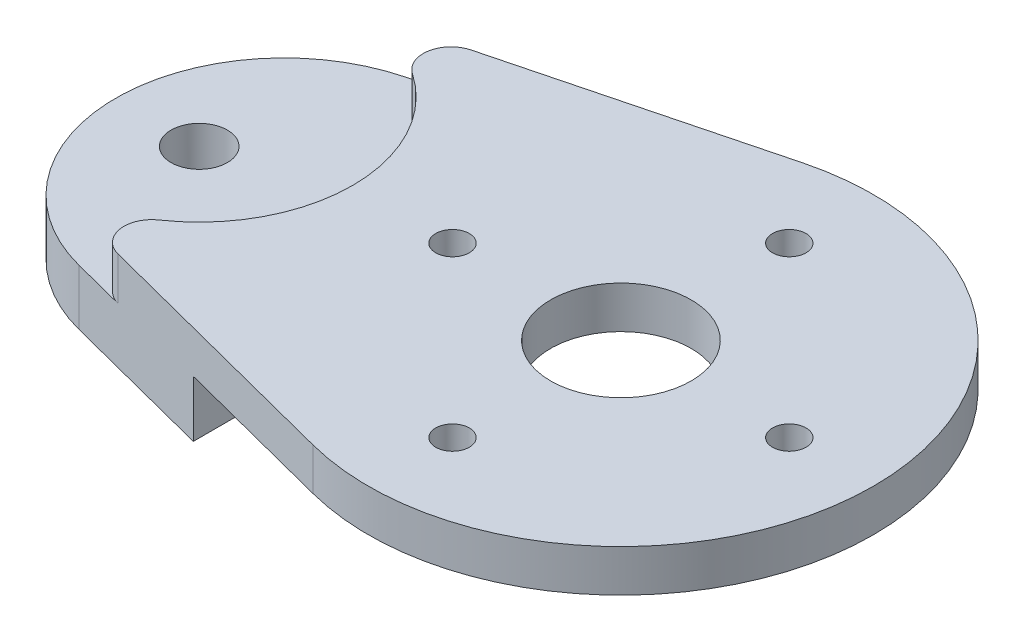
from build123d import *

# Parameters (mm, degrees)
BOSS_EXTRUDE1_DEPTH     = 35.052
CUT_EXTRUDE1_DEPTH      = 231.935593134
CUT_EXTRUDE1_DEPTH_BACK = 231.935593134
SKETCH2_R               = 25.019
SKETCH2_R_2             = 10.033
CUT_EXTRUDE2_START      = -15.24
CUT_EXTRUDE2_DEPTH      = 15.24
FILLET1_R               = 9.906
SKETCH5_R               = 5.969
CUT_EXTRUDE3_DEPTH      = 231.935593134
CIRPATTERN1_COUNT       = 4
SKETCH6_W               = 250.475884559
SKETCH6_H               = 232.654927102
CUT_EXTRUDE4_DEPTH      = 20.066


with BuildPart() as part:
    # Sketch1 → Boss-Extrude1 (new body)
    with BuildSketch(Plane(origin=(0, 0, 0), x_dir=(1, 0, 0), z_dir=(0, 1, 0))):
        with BuildLine():
            Line((-14.986, 58.040528426), (97.409, 87.060792639))
            ThreePointArc((97.409, 87.060792639), (209.804, 0), (97.409, -87.060792639))
            Line((97.409, -87.060792639), (-14.986, -58.040528426))
            ThreePointArc((-14.986, -58.040528426), (-59.944, 0), (-14.986, 58.040528426))
        make_face()
    extrude(amount=BOSS_EXTRUDE1_DEPTH)

    # Sketch2 → Cut-Extrude1 (cut, two sides: drawn at the far end of the back side and taken through both)
    with BuildSketch(Plane(origin=(0, 35.052, 0), x_dir=(1, 0, 0), z_dir=(0, 1, 0)).offset(-CUT_EXTRUDE1_DEPTH_BACK)):
        with Locations(Location((119.888, 0, 0), (0, 0, 270))):
            Circle(SKETCH2_R)
        with Locations(Location((-30.226, 0, 0), (0, 0, 270))):
            Circle(SKETCH2_R_2)
    extrude(amount=CUT_EXTRUDE1_DEPTH + CUT_EXTRUDE1_DEPTH_BACK, mode=Mode.SUBTRACT)

    # Sketch3 → Cut-Extrude2 (cut)
    with BuildSketch(Plane(origin=(0, 35.052, 0), x_dir=(1, 0, 0), z_dir=(0, 1, 0)).offset(CUT_EXTRUDE2_START)):
        with BuildLine():
            ThreePointArc((-25.220705882, 54.380135443), (-59.944, 0), (-25.220705882, -54.380135443))
            ThreePointArc((-25.220705882, -54.380135443), (24.384, 0), (-25.220705882, 54.380135443))
        make_face()
    extrude(amount=CUT_EXTRUDE2_DEPTH, mode=Mode.SUBTRACT)

    # Fillet1
    # the kernel refuses this fillet: 9.906 mm, written as the material it takes off along each edge
    with BuildSketch(Plane(origin=(-25.220705882, 19.812, -54.380135443), x_dir=(0.9595509242122834, 0, -0.28153512008868975), z_dir=(0, 1, 0))) as fillet1_piece_1:
        with BuildLine():
            CenterArc((29.806229626, -9.900699967), FILLET1_R, 88.125665331, 131.182876807)
            Line((22.141504015, -16.176113683), (21.375031454, -16.803655054))
            ThreePointArc((21.375031454, -16.803655054), (11.518208373, -7.475588537), (-0.364835977, -0.92096855))
            Line((-0.364835977, -0.92096855), (-0.146921489, 0.979644035))
            ThreePointArc((-0.146921489, 0.979644035), (10.883650693, 1.620974317), (30.162629918, 0.990069997))
            Line((30.162629918, 0.990069997), (30.130229891, 0))
        make_face()
    extrude(amount=90.565574728, mode=Mode.SUBTRACT)
    with BuildSketch(Plane(origin=(-25.220705882, 19.812, 54.380135443), x_dir=(0.9595509242122835, 0, 0.2815351200886891), z_dir=(0, 1, 0))) as fillet1_piece_2:
        with BuildLine():
            CenterArc((29.806229626, 9.900699967), FILLET1_R, 140.691457861, 131.182876807)
            Line((22.141504015, 16.176113683), (21.375031454, 16.803655054))
            ThreePointArc((21.375031454, 16.803655054), (11.518208373, 7.475588537), (-0.364835977, 0.92096855))
            Line((-0.364835977, 0.92096855), (-0.146921489, -0.979644035))
            ThreePointArc((-0.146921489, -0.979644035), (10.883650693, -1.620974317), (30.162629918, -0.990069997))
            Line((30.162629918, -0.990069997), (30.130229891, 0))
        make_face()
    extrude(amount=90.565574728, mode=Mode.SUBTRACT)

    # Sketch5 → Cut-Extrude3 (cut, through all)
    with BuildSketch(Plane(origin=(0, 35.052, 0), x_dir=(1, 0, 0), z_dir=(0, 1, 0))):
        with Locations(Location((179.832, 0, 0), (0, 0, 270))):
            Circle(SKETCH5_R)
    cut_extrude3 = extrude(amount=-CUT_EXTRUDE3_DEPTH, mode=Mode.SUBTRACT)

    # CirPattern1: Cut-Extrude3 ×4 about axis
    cirpattern1_axis = Axis((119.888, 0, 0), (0, 1, 0))
    for i in range(1, CIRPATTERN1_COUNT):
        add(cut_extrude3.rotate(cirpattern1_axis, i * 360 / CIRPATTERN1_COUNT), mode=Mode.SUBTRACT)

    # Sketch6 → Cut-Extrude4 (cut)
    with BuildSketch(Plane.XZ):
        with Locations((165.115942279, 0)):
            Rectangle(SKETCH6_W, SKETCH6_H)
    extrude(amount=-CUT_EXTRUDE4_DEPTH, mode=Mode.SUBTRACT)


solid = part.part
